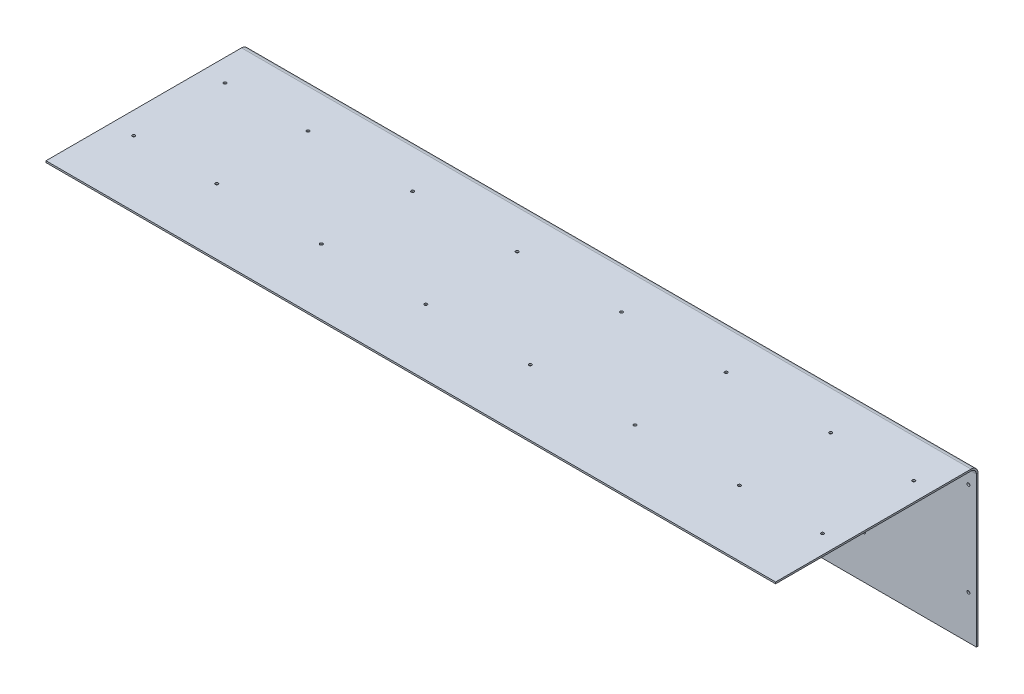
from build123d import *

# Parameters (mm, degrees)
CROQUIS1_W                       = 1396
CROQUIS1_H                       = 387.3
BRIDA_BASE1_DEPTH                = 3.175
TALADRO_DE_MARGEN_PARA_M51_D     = 5.5
BRIDA_DE_ARISTA1_STRIP_W         = 32.7
BRIDA_DE_ARISTA1_STRIP_H         = 3.175
BRIDA_DE_ARISTA1_STRIP_CUT_DEPTH = 1396
BRIDA_DE_ARISTA1_DEPTH           = 1396
TALADRO_DE_MARGEN_PARA_M52_D     = 5.5


# Sheet-metal steps are written as plain solids
with BuildPart() as part:
    # Croquis1 → Brida base1 (new body)
    with BuildSketch(Plane(origin=(0, 0, 0), x_dir=(1, 0, 0), z_dir=(0, 1, 0))):
        with Locations((-11.780590717, 234.868987342)):
            Rectangle(CROQUIS1_W, CROQUIS1_H)
    extrude(amount=-BRIDA_BASE1_DEPTH)

    # Taladro de margen para M51 (through all)
    with Locations(Plane(origin=(0, -3.175, 0), x_dir=(-1, 0, 0), z_dir=(0, -1, 0))):
        with Locations((508.430590717, 166.618987342), (508.430590717, 341.218987342), (308.430590717, 166.618987342), (308.430590717, 341.218987342), (108.430590717, 166.618987342), (108.430590717, 341.218987342), (-91.569409283, 166.618987342), (-91.569409283, 341.218987342), (-291.569409283, 166.618987342), (-291.569409283, 341.218987342), (-491.569409283, 166.618987342), (-491.569409283, 341.218987342), (667.430590717, 166.618987342), (667.430590717, 341.218987342), (-650.569409283, 166.618987342), (-650.569409283, 341.218987342)):
            Hole(TALADRO_DE_MARGEN_PARA_M51_D / 2)

    # Brida de arista1 strip (across the edge) → Brida de arista1 strip cut (cut)
    with BuildSketch(Plane(origin=(-709.780590717, -3.175, -428.518987342), x_dir=(0, 0, 1), z_dir=(1, 0, 0))):
        with Locations((-3.175, -1.5875)):
            Rectangle(BRIDA_DE_ARISTA1_STRIP_W, BRIDA_DE_ARISTA1_STRIP_H)
    extrude(amount=BRIDA_DE_ARISTA1_STRIP_CUT_DEPTH, mode=Mode.SUBTRACT)

    # Brida de arista1 section (across the edge) → Brida de arista1 (add)
    with BuildSketch(Plane(origin=(-709.780590717, -3.175, -428.518987342), x_dir=(0, 0, 1), z_dir=(1, 0, 0))):
        with BuildLine():
            Line((0, 10), (0, 296.825))
            Line((0, 296.825), (3.175, 296.825))
            Line((3.175, 296.825), (3.175, 10))
            ThreePointArc((3.175, 10), (6.103932188, 2.928932188), (13.175, 0))
            Line((13.175, 0), (13.175, -3.175))
            ThreePointArc((13.175, -3.175), (3.858868158, 0.683868158), (0, 10))
        make_face()
    extrude(amount=BRIDA_DE_ARISTA1_DEPTH)

    # Taladro de margen para M52 (through all)
    with Locations(Plane.XY.offset(-425.343987342)):
        with Locations((-687.930590717, -216.9), (-687.930590717, -38.2), (-487.930590717, -216.9), (-487.930590717, -38.2), (-287.930590717, -216.9), (-287.930590717, -38.2), (-128.930590717, -216.9), (-128.930590717, -38.2), (71.069409283, -216.9), (71.069409283, -38.2), (271.069409283, -216.9), (271.069409283, -38.2), (471.069409283, -216.9), (471.069409283, -38.2), (671.069409283, -216.9), (671.069409283, -38.2)):
            Hole(TALADRO_DE_MARGEN_PARA_M52_D / 2)


solid = part.part
